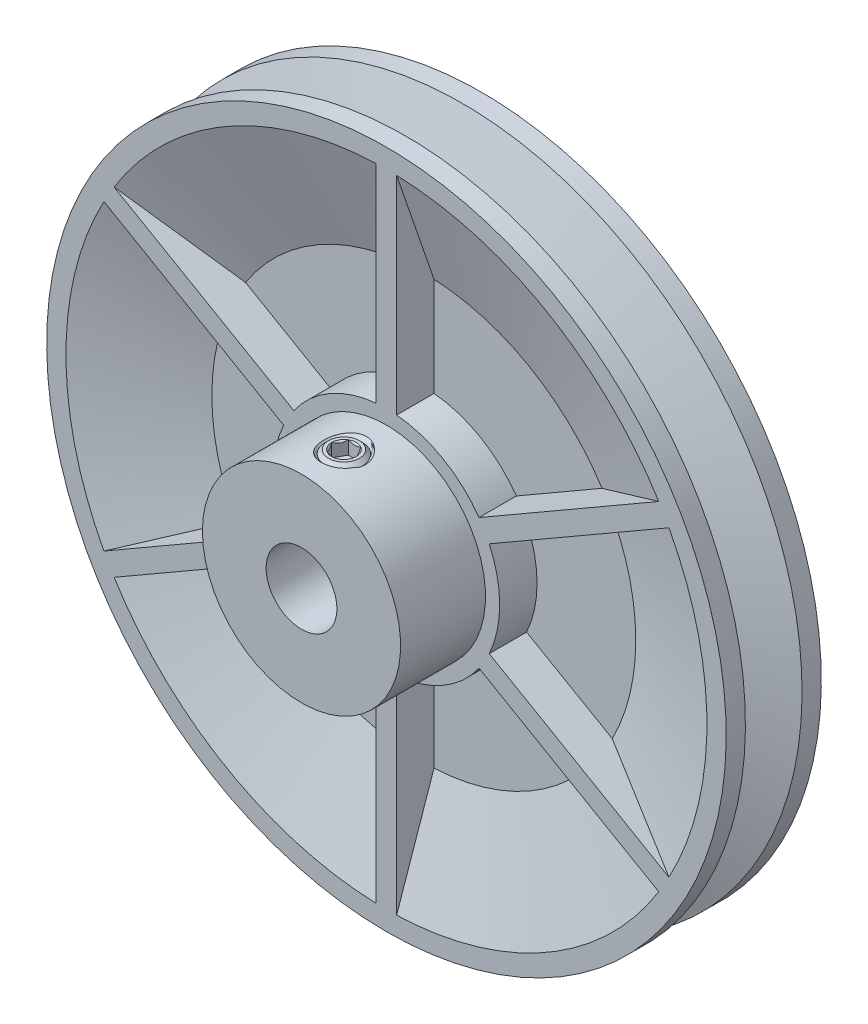
from build123d import *

# Parameters (mm, degrees)
BOSS_EXTRUDE1_DEPTH     = 1.143
CIRPATTERN1_COUNT       = 6
SKETCH4_R               = 3.96875
CUT_EXTRUDE1_DEPTH      = 22.225
CUT_EXTRUDE2_REACH      = 65.986
CUT_EXTRUDE2_END_RADIUS = 3.96875
SKETCH5_R               = 1.751541667
CUT_SWEEP1_PITCH        = 1.058333333
CUT_EXTRUDE4_DEPTH      = 1.48828125


with BuildPart() as part:
    # Sketch1 → Revolve1 (revolve)
    with BuildSketch(Plane(origin=(0, 0, 0), x_dir=(0, 0, -1), z_dir=(1, 0, 0)), mode=Mode.PRIVATE) as revolve1_sk:
        Polygon((3.175, 38.1), (5.334, 38.1), (5.334, 35.941), (1.143, 23.769452212), (1.143, 12.7), (5.334, 12.7), (5.334, 7.9375), (-5.334, 7.9375), (-5.334, 12.7), (-1.143, 12.7), (-1.143, 23.769452212), (-5.334, 35.941), (-5.334, 38.1), (-3.175, 38.1), (-0.988519656, 31.75), (0.988519656, 31.75), align=None)
    revolve(revolve1_sk.sketch.rotate(Axis((0, 0, 14.859), (0, 0, -1)), 180), axis=Axis((0, 0, 14.859), (0, 0, -1)))

    # Sketch2 → Boss-Extrude1 (add, symmetric)
    with BuildSketch(Plane(origin=(0, 0, 0), x_dir=(0, 0, -1), z_dir=(1, 0, 0))):
        Polygon((-1.143, 23.769452212), (-1.143, 7.9375), (-5.334, 7.9375), (-5.334, 35.941), align=None)
        Polygon((5.334, 35.941), (5.334, 7.9375), (1.143, 7.9375), (1.143, 23.769452212), align=None)
    boss_extrude1 = extrude(amount=BOSS_EXTRUDE1_DEPTH, both=True)

    # CirPattern1: Boss-Extrude1 ×6 about axis
    cirpattern1_axis = Axis((0, 0, 0), (0, 0, 1))
    for i in range(1, CIRPATTERN1_COUNT):
        add(boss_extrude1.rotate(cirpattern1_axis, i * 360 / CIRPATTERN1_COUNT))


with BuildPart() as body_2:
    # Sketch3 → Revolve2 (revolve)
    with BuildSketch(Plane(origin=(0, 0, 0), x_dir=(0, 0, -1), z_dir=(1, 0, 0)), mode=Mode.PRIVATE) as revolve2_sk:
        Polygon((7.366, 0), (7.366, 7.9375), (-5.334, 7.9375), (-5.334, 11.1125), (-14.859, 11.1125), (-14.859, 0), align=None)
    revolve(revolve2_sk.sketch.rotate(Axis((0, 0, -7.366), (0, 0, 1)), 90), axis=Axis((0, 0, -7.366), (0, 0, 1)))

    # Sketch4 → Cut-Extrude1 (cut)
    with BuildSketch(Plane(origin=(0, 0, -7.366), x_dir=(-1, 0, 0), z_dir=(0, 0, -1))):
        Circle(SKETCH4_R)
    extrude(amount=-CUT_EXTRUDE1_DEPTH, mode=Mode.SUBTRACT)

    # Cut-Extrude2: up to this cylinder (the profile starts outside it)
    cut_extrude2_end = Plane(origin=(0, 0, 10.0965), z_dir=(0, 0, -1)) * Cylinder(CUT_EXTRUDE2_END_RADIUS, 140.9095, mode=Mode.PRIVATE)
    # Sketch5 → Cut-Extrude2 (cut, up to the surface)
    with BuildSketch(Plane(origin=(0, 11.1125, 0), x_dir=(-1, 0, 0), z_dir=(0, 1, 0)), mode=Mode.PRIVATE) as cut_extrude2_sk1:
        with Locations(Location((0, 10.0965, 0), (0, 0, 90))):
            Circle(SKETCH5_R)
    cut_extrude2_tool1 = extrude(cut_extrude2_sk1.sketch, amount=-CUT_EXTRUDE2_REACH, mode=Mode.PRIVATE) - cut_extrude2_end
    add(cut_extrude2_tool1.solids().sort_by_distance((0, 11.1125, 10.0965))[0], mode=Mode.SUBTRACT)

    # Cut-Sweep1: the profile of Sketch7 screwed along a right-hand helix of 11.5 turns, 8 arcs to a turn; built about Z, then put on its axis
    cut_sweep1_z = Axis((0, 0, 0), (0, 0, 1))
    cut_sweep1_corners = [(1.668308364, 0, -1.025260417), (1.668308364, 0, -0.033072917), (2.413, 0, -0.463020833), (2.413, 0, -0.5953125)]
    with BuildLine(mode=Mode.PRIVATE) as cut_sweep1_profile:
        Line(cut_sweep1_corners[0], cut_sweep1_corners[1])
        Line(cut_sweep1_corners[1], cut_sweep1_corners[2])
        Line(cut_sweep1_corners[2], cut_sweep1_corners[3])
        Line(cut_sweep1_corners[3], cut_sweep1_corners[0])
    cut_sweep1_cap = Face(cut_sweep1_profile.wire())
    cut_sweep1_turn_angles = [0, 22.5, 45, 67.5, 90, 112.5, 135, 157.5, 180, 202.5, 225, 247.5, 270, 292.5, 315, 337.5, 360]
    cut_sweep1_turn_weights = [1, 0.9238795325112867, 1, 0.9238795325112867, 1, 0.9238795325112867, 1, 0.9238795325112867, 1, 0.9238795325112867, 1, 0.9238795325112867, 1, 0.9238795325112867, 1, 0.9238795325112867, 1]
    cut_sweep1_turn_rails = [Edge.make_bspline([Vector(p[0], p[1], 0).rotate(cut_sweep1_z, cut_sweep1_turn_angles[k]) / cut_sweep1_turn_weights[k] + Vector(0, 0, p[2] + CUT_SWEEP1_PITCH * cut_sweep1_turn_angles[k] / 360) for k in range(17)], [0, 0, 0, 1, 1, 2, 2, 3, 3, 4, 4, 5, 5, 6, 6, 7, 7, 8, 8, 8], 2, cut_sweep1_turn_weights) for p in cut_sweep1_corners]
    cut_sweep1_turn_sides = [Face.make_surface_from_curves(cut_sweep1_turn_rails[p[0]], cut_sweep1_turn_rails[p[1]]) for p in [(0, 1), (1, 2), (2, 3), (3, 0)]]
    cut_sweep1_last_angles = [3960, 3982.5, 4005, 4027.5, 4050, 4072.5, 4095, 4117.5, 4140]
    cut_sweep1_last_weights = [1, 0.9238795325112867, 1, 0.9238795325112867, 1, 0.9238795325112867, 1, 0.9238795325112867, 1]
    cut_sweep1_last_rails = [Edge.make_bspline([Vector(p[0], p[1], 0).rotate(cut_sweep1_z, cut_sweep1_last_angles[k]) / cut_sweep1_last_weights[k] + Vector(0, 0, p[2] + CUT_SWEEP1_PITCH * cut_sweep1_last_angles[k] / 360) for k in range(9)], [0, 0, 0, 1, 1, 2, 2, 3, 3, 4, 4, 4], 2, cut_sweep1_last_weights) for p in cut_sweep1_corners]
    cut_sweep1_last_sides = [Face.make_surface_from_curves(cut_sweep1_last_rails[p[0]], cut_sweep1_last_rails[p[1]]) for p in [(0, 1), (1, 2), (2, 3), (3, 0)]]
    cut_sweep1 = Plane(origin=(0, 11.1125, 10.0965), x_dir=(0, 0, 1), z_dir=(0, -1, 0)) * Solid(Shell([*[p.moved(Location((0, 0, CUT_SWEEP1_PITCH * i))) for i in range(11) for p in cut_sweep1_turn_sides], *cut_sweep1_last_sides, cut_sweep1_cap, cut_sweep1_cap.rotate(cut_sweep1_z, 4140).moved(Location((0, 0, CUT_SWEEP1_PITCH * 4140 / 360)))]))
    add(cut_sweep1, mode=Mode.SUBTRACT)

    # Cut-Extrude3 cone 1 section (through the dimple's axis) → Cut-Extrude3 (revolve, cut)
    with BuildSketch(Plane(origin=(0, 11.1125, 10.0965), x_dir=(0, 0, 1), z_dir=(1, 0, 0))):
        Polygon((0, 0), (2.527567944, 0), (0, 2.527567944), align=None)
    revolve(axis=Axis((0, 11.1125, 10.0965), (0, -1, 0)), mode=Mode.SUBTRACT)


with BuildPart() as body_3:
    # Sketch9 → Revolve3 (revolve)
    with BuildSketch(Plane(origin=(0, 0, 0), x_dir=(0, 0, -1), z_dir=(1, 0, 0))):
        Polygon((-12.5095, 5.449907664), (-12.5095, 10.425092336), (-11.822092336, 11.1125), (-10.0965, 11.1125), (-10.0965, 4.7625), (-11.822092336, 4.7625), align=None)
    revolve(axis=Axis((0, 11.1125, 10.0965), (0, -1, 0)))

    # Sketch10 → Cut-Extrude4 (cut)
    with BuildSketch(Plane(origin=(0, 11.1125, 0), x_dir=(1, 0, 0), z_dir=(0, 1, 0))):
        Polygon((1.374815329, -10.0965), (0.687407664, -8.905875), (-0.687407664, -8.905875), (-1.374815329, -10.0965), (-0.687407664, -11.287125), (0.687407664, -11.287125), align=None)
    extrude(amount=-CUT_EXTRUDE4_DEPTH, mode=Mode.SUBTRACT)

    # Cut-Extrude5 cone 1 section (through the dimple's axis) → Cut-Extrude5 (revolve, cut)
    with BuildSketch(Plane(origin=(0, 11.1125, 10.0965), x_dir=(0, 0, 1), z_dir=(1, 0, 0))):
        Polygon((0, 0), (1.374815329, 0), (0, 1.374815329), align=None)
    revolve(axis=Axis((0, 11.1125, 10.0965), (0, -1, 0)), mode=Mode.SUBTRACT)


solid = Compound([part.part, body_2.part, body_3.part])
